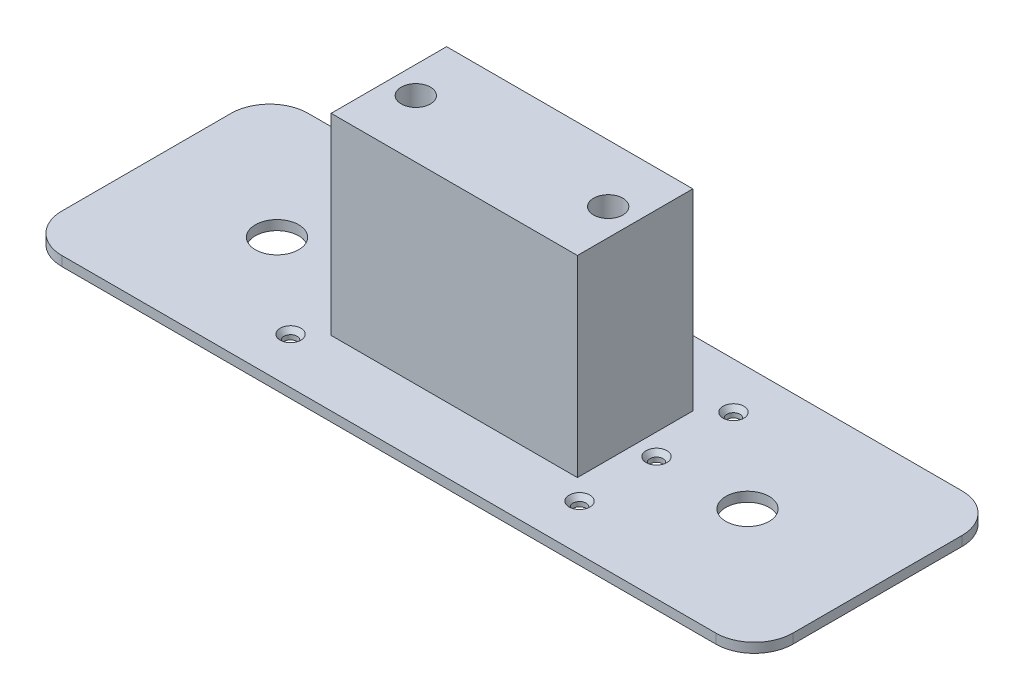
from build123d import *

# Parameters (mm, degrees)
SKETCH1_W                      = 120.65
SKETCH1_H                      = 40.64
BOSS_EXTRUDE1_DEPTH            = 1.5875
FILLET1_R                      = 6.35
SKETCH2_W                      = 40.64
SKETCH2_H                      = 19.05
BOSS_EXTRUDE2_DEPTH            = 31.75
F_10_CLEARANCE_HOLE1_D         = 4.826
F_10_CLEARANCE_HOLE1_DEPTH     = 25.4
F_10_CLEARANCE_HOLE1_TIP       = 1.449876674
F_2_CLEARANCE_HOLE1_AT_2_COUNT = 2
F_2_CLEARANCE_HOLE1_AT_2_PITCH = 12.7
F_2_CLEARANCE_HOLE1_AT_3_COUNT = 2
F_2_CLEARANCE_HOLE1_AT_3_PITCH = 25.4
F_2_CLEARANCE_HOLE1_AT_4_COUNT = 2
F_2_CLEARANCE_HOLE1_AT_4_PITCH = 54.041188126
F_2_CLEARANCE_HOLE1_AT_5_COUNT = 2
F_2_CLEARANCE_HOLE1_AT_5_PITCH = 49.361726207
F_2_CLEARANCE_HOLE1_AT_6_COUNT = 2
F_2_CLEARANCE_HOLE1_AT_6_PITCH = 47.700000148
SKETCH13_R                     = 3.5749992
CUT_EXTRUDE1_DEPTH             = 72.856780691


with BuildPart() as part:
    # Sketch1 → Boss-Extrude1 (new body)
    with BuildSketch(Plane(origin=(0, 0, 0), x_dir=(1, 0, 0), z_dir=(0, 1, 0))):
        Rectangle(SKETCH1_W, SKETCH1_H)
    extrude(amount=BOSS_EXTRUDE1_DEPTH)

    # Fillet1
    fillet1_edges = [part.edges().sort_by_distance(p)[0] for p in [
        (-60.325, 0.79375, 20.32),
        (-60.325, 0.79375, -20.32),
        (60.325, 0.79375, -20.32),
        (60.325, 0.79375, 20.32),
    ]]
    fillet(fillet1_edges, radius=FILLET1_R)

    # Sketch2 → Boss-Extrude2 (add)
    with BuildSketch(Plane(origin=(0, 1.5875, 0), x_dir=(1, 0, 0), z_dir=(0, 1, 0))):
        Rectangle(SKETCH2_W, SKETCH2_H)
    extrude(amount=BOSS_EXTRUDE2_DEPTH)

    # #10 Clearance Hole1
    with Locations(Plane(origin=(0, 33.3375, 0), x_dir=(1, 0, 0), z_dir=(0, 1, 0))):
        with Locations((-15.875, 0), (15.875, 0)):
            Hole(F_10_CLEARANCE_HOLE1_D / 2, depth=F_10_CLEARANCE_HOLE1_DEPTH)
            with Locations((0, 0, -(F_10_CLEARANCE_HOLE1_DEPTH + F_10_CLEARANCE_HOLE1_TIP / 2))):  # 118° drill point
                Cone(0, F_10_CLEARANCE_HOLE1_D / 2, F_10_CLEARANCE_HOLE1_TIP, mode=Mode.SUBTRACT)

    # Sketch12 → #2 Clearance Hole1 (revolve, cut)
    with BuildSketch(Plane(origin=(-23.850000074, 1.5875, -12.7), x_dir=(0, 0, 1), z_dir=(1, 0, 0))):
        Polygon((0, 0), (0, 1.5875), (1.0795, 1.5875), (1.0795, 0.827548112), (1.7145, 0), align=None)
    f_2_clearance_hole1 = revolve(axis=Axis((-23.850000074, 7.9375, -12.7), (0, -1, 0)), mode=Mode.SUBTRACT)

    # #2 Clearance Hole1 at 2: #2 Clearance Hole1 ×2
    with Locations(*[(0, 0, i * F_2_CLEARANCE_HOLE1_AT_2_PITCH) for i in range(1, F_2_CLEARANCE_HOLE1_AT_2_COUNT)]):
        add(f_2_clearance_hole1, mode=Mode.SUBTRACT)

    # #2 Clearance Hole1 at 3: #2 Clearance Hole1 ×2
    with Locations(*[(0, 0, i * F_2_CLEARANCE_HOLE1_AT_3_PITCH) for i in range(1, F_2_CLEARANCE_HOLE1_AT_3_COUNT)]):
        add(f_2_clearance_hole1, mode=Mode.SUBTRACT)

    # #2 Clearance Hole1 at 4: #2 Clearance Hole1 ×2
    with Locations(*[Vector(0.8826600931937462, 0, 0.4700118720662355) * (i * F_2_CLEARANCE_HOLE1_AT_4_PITCH) for i in range(1, F_2_CLEARANCE_HOLE1_AT_4_COUNT)]):
        add(f_2_clearance_hole1, mode=Mode.SUBTRACT)

    # #2 Clearance Hole1 at 5: #2 Clearance Hole1 ×2
    with Locations(*[Vector(0.9663357385056085, 0, 0.2572843572524773) * (i * F_2_CLEARANCE_HOLE1_AT_5_PITCH) for i in range(1, F_2_CLEARANCE_HOLE1_AT_5_COUNT)]):
        add(f_2_clearance_hole1, mode=Mode.SUBTRACT)

    # #2 Clearance Hole1 at 6: #2 Clearance Hole1 ×2
    with Locations(*[(i * F_2_CLEARANCE_HOLE1_AT_6_PITCH, 0, 0) for i in range(1, F_2_CLEARANCE_HOLE1_AT_6_COUNT)]):
        add(f_2_clearance_hole1, mode=Mode.SUBTRACT)

    # Sketch13 → Cut-Extrude1 (cut, through all)
    with BuildSketch(Plane(origin=(0, 0, 0), x_dir=(-1, 0, 0), z_dir=(0, -1, 0))):
        with Locations((38.825000074, 0.042792778)):
            Circle(SKETCH13_R)
        with Locations((-38.825000074, 0.042792778)):
            Circle(SKETCH13_R)
    extrude(amount=-CUT_EXTRUDE1_DEPTH, mode=Mode.SUBTRACT)


solid = part.part
